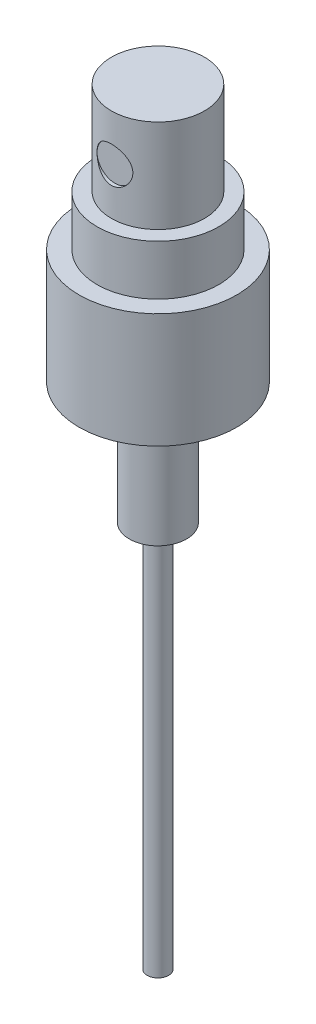
from build123d import *
from build123d.topology import SkipClean

# Parameters (mm, degrees)
SKETCH_1_R          = 11
EXTRUDE_1_DEPTH     = 16
SKETCH_2_R          = 10
CUT_EXTRUDE_1_DEPTH = 14
THREAD_2_PITCH      = 3.175
SKETCH_18_R         = 8.5
EXTRUDE_3_DEPTH     = 7
SKETCH_19_R         = 6.5
EXTRUDE_4_DEPTH     = 13
CUT_EXTRUDE_START   = 13
SKETCH_20_R         = 2.5
CUT_EXTRUDE_2_DEPTH = 7
SKETCH_21_R         = 4
EXTRUDE_5_DEPTH     = 31
SKETCH_22_R         = 1.5
EXTRUDE_6_DEPTH     = 54


with BuildPart() as part:
    # Эскиз1 → Бобышка-Вытянуть1 (new body)
    with BuildSketch(Plane(origin=(0, 0, 0), x_dir=(1, 0, 0), z_dir=(0, 1, 0))):
        with Locations(Location((0, 0, 0), (0, 0, 270))):
            Circle(SKETCH_1_R)
    extrude(amount=EXTRUDE_1_DEPTH)

    # Эскиз2 → Вырез-Вытянуть1 (cut)
    with BuildSketch(Plane.XZ):
        with Locations(Location((0, 0, 0), (0, 0, 270))):
            Circle(SKETCH_2_R)
    extrude(amount=-CUT_EXTRUDE_1_DEPTH, mode=Mode.SUBTRACT)

    # Резьба2: the profile of Профиль резьбы5 profile screwed along a right-hand helix of 2.204724 turns, 12 arcs to a turn; built about Z, then put on its axis
    with SkipClean():  # the faces are left unmerged after this step: merging them gives an invalid solid
        thread_2_z = Axis((0, 0, 0), (0, 0, 1))
        thread_2_corners = [(10.0006, 0, 0), (10.0006, 0, 2.662362041), (10, 0, 2.662362041), (9.790106637, 0, 2.412220872), (9.143093363, 0, 2.298134974), (8.9332, 0, 2.047993805), (8.9332, 0, 1.698061469), (9.156384633, 0, 1.159246102), (9.776815367, 0, 0.538815367), (10, 0, 0)]
        with BuildLine(mode=Mode.PRIVATE) as thread_2_profile:
            Line(thread_2_corners[0], thread_2_corners[1])
            Line(thread_2_corners[3], thread_2_corners[4])
            Line(thread_2_corners[5], thread_2_corners[6])
            Line(thread_2_corners[7], thread_2_corners[8])
            Line(thread_2_corners[9], thread_2_corners[0])
            Line(thread_2_corners[2], thread_2_corners[1])
            ThreePointArc((10, 0, 2.662362041), (9.940575289, 0, 2.499093988), (9.790106637, 0, 2.412220872))
            ThreePointArc((9.143093363, 0, 2.298134974), (8.992624711, 0, 2.211261858), (8.9332, 0, 2.047993805))
            ThreePointArc((8.9332, 0, 1.698061469), (8.991203796, 0, 1.406456694), (9.156384633, 0, 1.159246102))
            ThreePointArc((9.776815367, 0, 0.538815367), (9.941996204, 0, 0.291604775), (10, 0, 0))
        thread_2_cap = Face(thread_2_profile.wire())
        thread_2_arcs = [((10, 0, 2.662362041), (10, 0, 2.449230735), (9.790106637, 0, 2.412220872), (1, 0.7660444431189758, 1)), ((9.143093363, 0, 2.298134974), (8.9332, 0, 2.261125112), (8.9332, 0, 2.047993805), (1, 0.7660444431189757, 1)), ((8.9332, 0, 1.698061469), (8.9332, 0, 1.382430735), (9.156384633, 0, 1.159246102), (1, 0.923879532511285, 1)), ((9.776815367, 0, 0.538815367), (10, 0, 0.315630735), (10, 0, 0), (1, 0.9238795325112861, 1))]  # start, shoulder, end, weights
        thread_2_turn_angles = [0, 15, 30, 45, 60, 75, 90, 105, 120, 135, 150, 165, 180, 195, 210, 225, 240, 255, 270, 285, 300, 315, 330, 345, 360]
        thread_2_turn_weights = [1, 0.9659258262890683, 1, 0.9659258262890683, 1, 0.9659258262890683, 1, 0.9659258262890683, 1, 0.9659258262890683, 1, 0.9659258262890683, 1, 0.9659258262890683, 1, 0.9659258262890683, 1, 0.9659258262890683, 1, 0.9659258262890683, 1, 0.9659258262890683, 1, 0.9659258262890683, 1]
        thread_2_turn_rails = [Edge.make_bspline([Vector(p[0], p[1], 0).rotate(thread_2_z, thread_2_turn_angles[k]) / thread_2_turn_weights[k] + Vector(0, 0, p[2] + THREAD_2_PITCH * thread_2_turn_angles[k] / 360) for k in range(25)], [0, 0, 0, 1, 1, 2, 2, 3, 3, 4, 4, 5, 5, 6, 6, 7, 7, 8, 8, 9, 9, 10, 10, 11, 11, 12, 12, 12], 2, thread_2_turn_weights) for p in thread_2_corners]
        thread_2_turn_sides = [*[Face.make_surface_from_curves(thread_2_turn_rails[p[0]], thread_2_turn_rails[p[1]]) for p in [(0, 1), (3, 4), (5, 6), (7, 8), (9, 0), (2, 1)]], *[Face.make_bezier_surface([[Vector(p[j][0], p[j][1], 0).rotate(thread_2_z, thread_2_turn_angles[2 * i + k]) / thread_2_turn_weights[2 * i + k] + Vector(0, 0, p[j][2] + THREAD_2_PITCH * thread_2_turn_angles[2 * i + k] / 360) for k in range(3)] for j in range(3)], [[p[3][j] * thread_2_turn_weights[2 * i + k] for k in range(3)] for j in range(3)]) for p in thread_2_arcs for i in range(12)]]
        thread_2_last_angles = [720, 735, 750, 765, 780, 786.850393701, 793.700787402]
        thread_2_last_weights = [1, 0.9659258262890683, 1, 0.9659258262890683, 1, 0.9928609834962963, 1]
        thread_2_last_rails = [Edge.make_bspline([Vector(p[0], p[1], 0).rotate(thread_2_z, thread_2_last_angles[k]) / thread_2_last_weights[k] + Vector(0, 0, p[2] + THREAD_2_PITCH * thread_2_last_angles[k] / 360) for k in range(7)], [0, 0, 0, 1, 1, 2, 2, 3, 3, 3], 2, thread_2_last_weights) for p in thread_2_corners]
        thread_2_last_sides = [*[Face.make_surface_from_curves(thread_2_last_rails[p[0]], thread_2_last_rails[p[1]]) for p in [(0, 1), (3, 4), (5, 6), (7, 8), (9, 0), (2, 1)]], *[Face.make_bezier_surface([[Vector(p[j][0], p[j][1], 0).rotate(thread_2_z, thread_2_last_angles[2 * i + k]) / thread_2_last_weights[2 * i + k] + Vector(0, 0, p[j][2] + THREAD_2_PITCH * thread_2_last_angles[2 * i + k] / 360) for k in range(3)] for j in range(3)], [[p[3][j] * thread_2_last_weights[2 * i + k] for k in range(3)] for j in range(3)]) for p in thread_2_arcs for i in range(3)]]
        thread_2 = Plane(origin=(0, 14, 0), x_dir=(-1, 0, 0), z_dir=(0, -1, 0)) * Solid(Shell([*[p.moved(Location((0, 0, THREAD_2_PITCH * i))) for i in range(2) for p in thread_2_turn_sides], *thread_2_last_sides, thread_2_cap, thread_2_cap.rotate(thread_2_z, 793.700787402).moved(Location((0, 0, THREAD_2_PITCH * 793.700787402 / 360)))]))
        add(thread_2)

    # Эскиз18 → Бобышка-Вытянуть3 (add)
    with SkipClean():  # the faces are left unmerged after this step: merging them gives an invalid solid
        with BuildSketch(Plane(origin=(0, 16, 0), x_dir=(1, 0, 0), z_dir=(0, 1, 0))):
            with Locations(Location((0, 0, 0), (0, 0, 270))):
                Circle(SKETCH_18_R)
        extrude(amount=EXTRUDE_3_DEPTH)

    # Эскиз19 → Бобышка-Вытянуть4 (add)
    with SkipClean():  # the faces are left unmerged after this step: merging them gives an invalid solid
        with BuildSketch(Plane(origin=(0, 23, 0), x_dir=(1, 0, 0), z_dir=(0, 1, 0))):
            with Locations(Location((0, 0, 0), (0, 0, 90))):
                Circle(SKETCH_19_R)
        extrude(amount=EXTRUDE_4_DEPTH)

    # Эскиз20 → Вырез-Вытянуть2 (cut)
    with SkipClean():  # the faces are left unmerged after this step: merging them gives an invalid solid
        with BuildSketch(Plane.XY.offset(CUT_EXTRUDE_START)):
            with Locations((0, 29.5)):
                Circle(SKETCH_20_R)
        extrude(amount=-CUT_EXTRUDE_2_DEPTH, mode=Mode.SUBTRACT)

    # Эскиз21 → Бобышка-Вытянуть5 (add)
    with SkipClean():  # the faces are left unmerged after this step: merging them gives an invalid solid
        with BuildSketch(Plane.XZ.offset(-14)):
            with Locations(Location((0, 0, 0), (0, 0, 270))):
                Circle(SKETCH_21_R)
        extrude(amount=EXTRUDE_5_DEPTH)

    # Эскиз22 → Бобышка-Вытянуть6 (add)
    with SkipClean():  # the faces are left unmerged after this step: merging them gives an invalid solid
        with BuildSketch(Plane.XZ.offset(17)):
            with Locations(Location((0, 0, 0), (0, 0, 270))):
                Circle(SKETCH_22_R)
        extrude(amount=EXTRUDE_6_DEPTH)


solid = part.part
